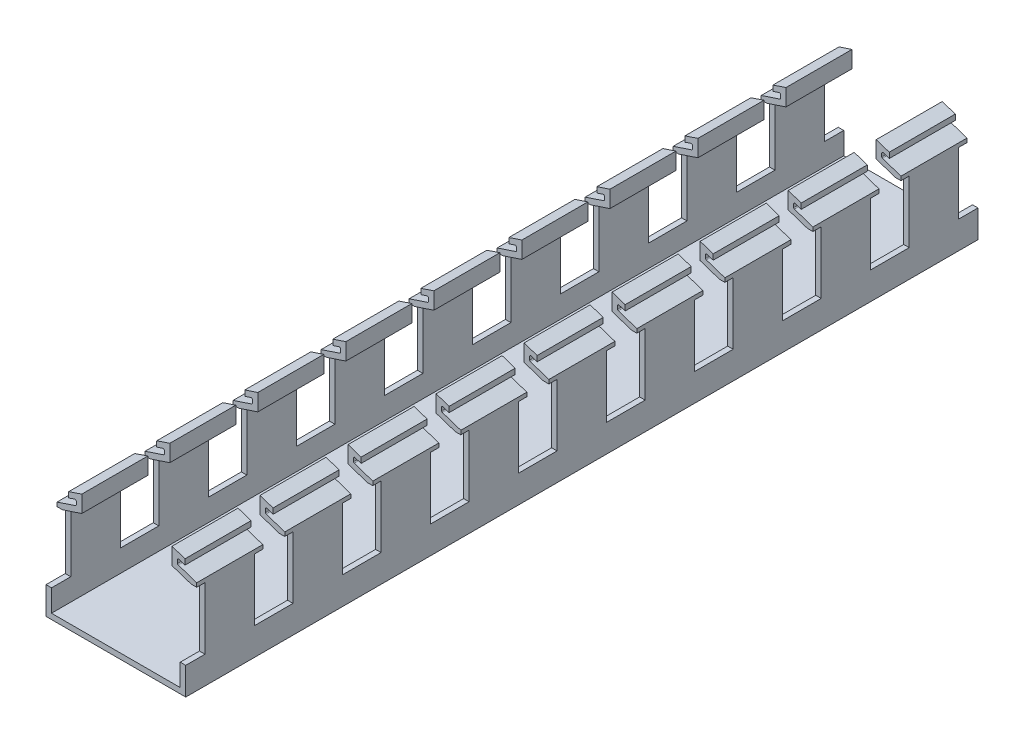
from build123d import *

# Parameters (mm, degrees)
SALIENTE_EXTRUIR1_DEPTH = 8
CORTAR_EXTRUIR1_DEPTH   = 33
MATRIZL1_COUNT          = 9
MATRIZL1_PITCH          = 16


with BuildPart() as part:
    # Croquis2 → Saliente-Extruir1 (new, symmetric)
    with BuildSketch(Plane.XY):
        with BuildLine():
            Line((-12.7, 0), (12.7, 0))
            Line((12.7, 0), (12.7, 17))
            Line((12.7, 17), (9.336754447, 18.121081851))
            ThreePointArc((9.336754447, 18.121081851), (9.237751563, 18.193876454), (9.2, 18.310818511))
            Line((9.2, 18.310818511), (9.2, 18.889181489))
            ThreePointArc((9.2, 18.889181489), (9.283057943, 19.051429926), (9.463245553, 19.078918149))
            Line((9.463245553, 19.078918149), (10.571708245, 18.709430585))
            Line((10.571708245, 18.709430585), (10.571708245, 19.709430585))
            Line((10.571708245, 19.709430585), (8.2, 20.5))
            Line((8.2, 20.5), (8.2, 17.445907447))
            Line((8.2, 17.445907447), (11.7, 16.27924078))
            Line((11.7, 16.27924078), (11.7, 1))
            Line((11.7, 1), (-11.7, 1))
            Line((-11.7, 1), (-11.7, 16.27924078))
            Line((-11.7, 16.27924078), (-8.2, 17.445907447))
            Line((-8.2, 17.445907447), (-8.2, 20.5))
            Line((-8.2, 20.5), (-10.571708245, 19.709430585))
            Line((-10.571708245, 19.709430585), (-10.571708245, 18.709430585))
            Line((-10.571708245, 18.709430585), (-9.463245553, 19.078918149))
            ThreePointArc((-9.463245553, 19.078918149), (-9.283057943, 19.051429926), (-9.2, 18.889181489))
            Line((-9.2, 18.889181489), (-9.2, 18.310818511))
            ThreePointArc((-9.2, 18.310818511), (-9.237751563, 18.193876454), (-9.336754447, 18.121081851))
            Line((-9.336754447, 18.121081851), (-12.7, 17))
            Line((-12.7, 17), (-12.7, 0))
        make_face()
    saliente_extruir1 = extrude(amount=SALIENTE_EXTRUIR1_DEPTH, both=True)

    # Croquis3 → Cortar-Extruir1 (cut, symmetric)
    with BuildSketch(Plane(origin=(0, 0, 0), x_dir=(0, 0, -1), z_dir=(1, 0, 0))):
        Polygon((-8, 5), (-4.5, 5), (-4.5, 16.27924078), (-6, 16.27924078), (-6, 20.5), (-8, 20.5), align=None)
        Polygon((8, 20.5), (6, 20.5), (6, 16.27924078), (4.5, 16.27924078), (4.5, 5), (8, 5), align=None)
    cortar_extruir1 = extrude(amount=CORTAR_EXTRUIR1_DEPTH, both=True, mode=Mode.SUBTRACT)

    # MatrizL1: Saliente-Extruir1, Cortar-Extruir1 ×9
    with Locations(*[(0, 0, -i * MATRIZL1_PITCH) for i in range(1, MATRIZL1_COUNT)]):
        add(saliente_extruir1)
        add(cortar_extruir1, mode=Mode.SUBTRACT)


solid = part.part
